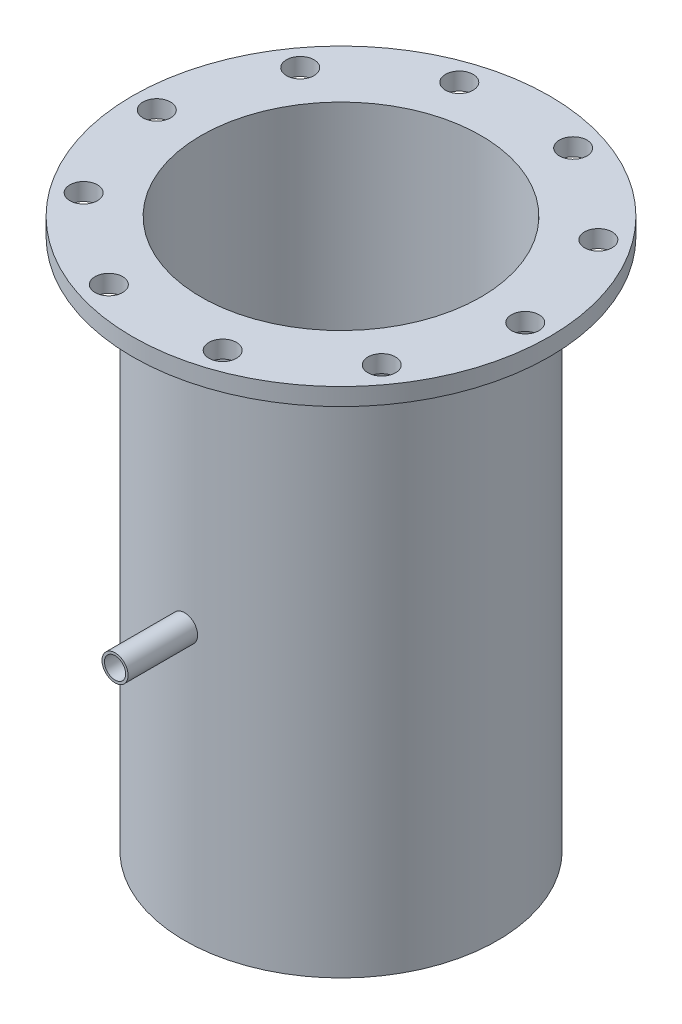
from build123d import *

# Parameters (mm, degrees)
TAP_DRILL_FOR_3_8_16_TAP1_D = 10.0838
CIRPATTERN1_COUNT           = 10
SKETCH4_R                   = 4.7625
SKETCH4_R_2                 = 3.8735
BOSS_EXTRUDE1_DEPTH         = 25.4


with BuildPart() as part:
    # Sketch1 → Revolve1 (revolve)
    with BuildSketch(Plane.XY):
        Polygon((51.1302, 0), (51.1302, -179.416363516), (53.6194, -179.416363516), (53.6194, -184.216963516), (51.1302, -184.216963516), (51.1302, -188.026963516), (53.848, -188.026963516), (53.848, -191.074963516), (51.1302, -191.074963516), (51.1302, -200.599963516), (57.15, -200.599963516), (57.15, -8.89), (54.61, -6.35), (76.2, -6.35), (76.2, 0), align=None)
    revolve(axis=Axis((0, 0, 0), (0, -1, 0)))

    # Tap Drill for 3/8-16 Tap1 (through all)
    with Locations(Plane(origin=(0, 0, 0), x_dir=(1, 0, 0), z_dir=(0, 1, 0))):
        with Locations((67.31, 0)):
            tap_drill_for_3_8_16_tap1 = Hole(TAP_DRILL_FOR_3_8_16_TAP1_D / 2)

    # CirPattern1: Tap Drill for 3/8-16 Tap1 ×10 about axis
    cirpattern1_axis = Axis((0, 0, 0), (0, 1, 0))
    for i in range(1, CIRPATTERN1_COUNT):
        add(tap_drill_for_3_8_16_tap1.rotate(cirpattern1_axis, i * 360 / CIRPATTERN1_COUNT), mode=Mode.SUBTRACT)

    # Sketch11 → 1/8 (0.125) Diameter Hole3 (revolve, cut)
    with BuildSketch(Plane(origin=(0, -101.6, 57.15), x_dir=(0, -1, 0), z_dir=(1, 0, 0))):
        Polygon((0, 0), (0, 26.353866233), (1.5875, 25.4), (1.5875, 0), align=None)
    revolve(axis=Axis((0, -101.6, 63.5), (0, 0, -1)), mode=Mode.SUBTRACT)


with BuildPart() as body_2:
    # Sketch4 → Boss-Extrude1 (new body)
    with BuildSketch(Plane.XY.offset(57.15)):
        with Locations((0, -101.6)):
            Circle(SKETCH4_R)
        with Locations((0, -101.6)):
            Circle(SKETCH4_R_2, mode=Mode.SUBTRACT)
    extrude(amount=BOSS_EXTRUDE1_DEPTH)


solid = Compound([part.part, body_2.part])
